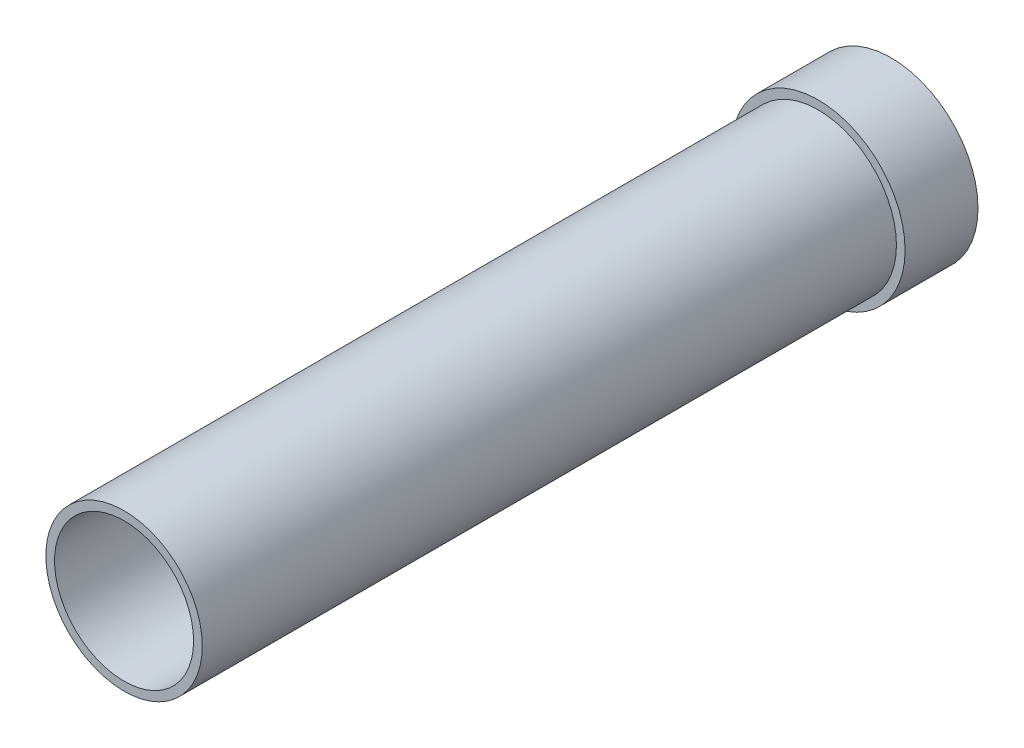
from build123d import *

# Parameters (mm, degrees)
SKETCH2_R           = 63.582050125
BOSS_EXTRUDE1_DEPTH = 2.54
DOME1_FACE_RADIUS   = 63.582050125
DOME1_HEIGHT        = 16.51
SKETCH3_R           = 63.582050125
SKETCH3_R_2         = 57.232050125
BOSS_EXTRUDE2_DEPTH = 50.8
SKETCH4_R           = 57.232050125
SKETCH4_R_2         = 50.882050125
BOSS_EXTRUDE3_DEPTH = 558.8
SKETCH5_R           = 50.882050125
BOSS_EXTRUDE4_DEPTH = 558.8


# Read off the part's stored shape, not the designer's step: Shell1
with BuildPart() as part:
    # Sketch2 → Boss-Extrude1 (new body)
    with BuildSketch(Plane.XY.offset(38.1)):
        with Locations((672.464575935, -1215.750984812)):
            Circle(SKETCH2_R)
    extrude(amount=BOSS_EXTRUDE1_DEPTH)

    # Dome1: a dome of height H over a round flat face of radius A is a cap of a sphere of radius (A * A + H * H) / (2 * H)
    dome1_r = (DOME1_FACE_RADIUS * DOME1_FACE_RADIUS + DOME1_HEIGHT * DOME1_HEIGHT) / (2 * DOME1_HEIGHT)
    dome1_base = Plane((672.464575935, -1215.750984812, 38.1), z_dir=(0, 0, -1))
    with Locations(dome1_base.offset(DOME1_HEIGHT - dome1_r)):
        dome1_ball = Sphere(dome1_r, mode=Mode.PRIVATE)
    add(split(dome1_ball, bisect_by=dome1_base, keep=Keep.TOP, mode=Mode.PRIVATE))

    # Sketch3 → Boss-Extrude2 (add)
    with BuildSketch(Plane.XY.offset(40.64)):
        with Locations((672.464575935, -1215.750984812)):
            Circle(SKETCH3_R)
        with Locations((672.464575935, -1215.750984812)):
            Circle(SKETCH3_R_2, mode=Mode.SUBTRACT)
    extrude(amount=BOSS_EXTRUDE2_DEPTH)

    # Sketch4 → Boss-Extrude3 (add)
    with BuildSketch(Plane.XY.offset(40.64)):
        with Locations((672.464575935, -1215.750984812)):
            Circle(SKETCH4_R)
        with Locations((672.464575935, -1215.750984812)):
            Circle(SKETCH4_R_2, mode=Mode.SUBTRACT)
    extrude(amount=BOSS_EXTRUDE3_DEPTH)

    # Sketch5 → Boss-Extrude4 (add)
    with BuildSketch(Plane.XY.offset(40.64)):
        with Locations((672.464575935, -1215.750984812)):
            Circle(SKETCH5_R)
    extrude(amount=BOSS_EXTRUDE4_DEPTH)

    # Shell1 outline → Shell1 (revolve, cut)
    with BuildSketch(Plane(origin=(672.464575935, -1215.750984812, 0), x_dir=(1, 0, 0), z_dir=(0, -1, 0))):
        with BuildLine():
            Line((57.232050162, 41.895123211), (57.232050125, 85.09))
            Line((57.232050125, 85.09), (50.882050125, 85.09))
            Line((50.882050125, 85.09), (50.882050125, 599.44))
            Line((50.882050125, 599.44), (0, 599.44))
            Line((0, 599.44), (0, 27.94))
            ThreePointArc((0, 27.94), (29.454426788, 31.47915065), (57.232050162, 41.895123211))
        make_face()
    revolve(axis=Axis((672.464575935, -1215.750984812, 0), (0, 0, 1)), mode=Mode.SUBTRACT)


solid = part.part
